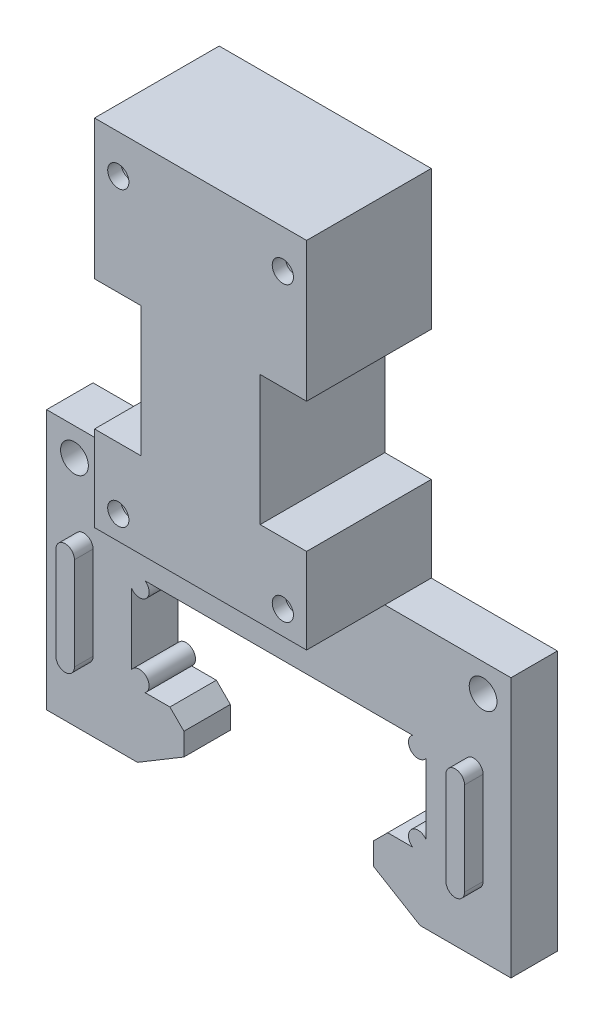
from build123d import *

# Parameters (mm, degrees)
ESQUISSE1_W             = 63.5
ESQUISSE1_H             = 35.56
BOSS_EXTRU_1_DEPTH      = 6.35
BOSS_EXTRU_2_DEPTH      = 2.54
EMPREINTE1_DEPTH        = 6.35
D_PLACER_LA_FACE2_DEPTH = 6.35
CHANFREIN1_SIZE         = 6.35
CHANFREIN1_SIZE2        = 3.81
CHANFREIN2_SIZE         = 6.35
CHANFREIN2_SIZE2        = 3.81
ESQUISSE3_W             = 29
ESQUISSE3_H             = 17.046330794
BOSS_EXTRU_3_DEPTH      = 48.514
ESQUISSE4_R             = 2.341041465
ENL_V_MAT_EXTRU_1_DEPTH = 15.24
ESQUISSE5_R             = 1.397
ESQUISSE5_W             = 6.35
ESQUISSE5_H             = 17.78
ENL_V_MAT_EXTRU_2_DEPTH = 78.134580407
D_GAGEMENT_M2_51_D      = 2.9
D_GAGEMENT_61_D         = 3.7973


# Read off the part's stored shape, not the designer's step: Empreinte1, Déplacer la face2
with BuildPart() as part:
    # Esquisse1 → Boss.-Extru.1 (new body)
    with BuildSketch(Plane.XY):
        with Locations((0, 1.905)):
            Rectangle(ESQUISSE1_W, ESQUISSE1_H)
    extrude(amount=BOSS_EXTRU_1_DEPTH)

    # Esquisse2 → Boss.-Extru.2 (add)
    with BuildSketch(Plane.XY.offset(6.35)):
        with BuildLine():
            Line((-27.94, -6.35), (-27.94, 6.35))
            ThreePointArc((-27.94, 6.35), (-26.67, 7.62), (-25.4, 6.35))
            Line((-25.4, 6.35), (-25.4, -6.35))
            ThreePointArc((-25.4, -6.35), (-26.67, -7.62), (-27.94, -6.35))
        make_face()
    boss_extru_2 = extrude(amount=BOSS_EXTRU_2_DEPTH)

    # Symétrie1: Boss.-Extru.2 across plane
    add(boss_extru_2.mirror(Plane(origin=(0, 0, 0), x_dir=(0, 0, 1), z_dir=(1, 0, 0))))

    # Empreinte1 outline → Empreinte1 (cut)
    with BuildSketch(Plane.XY):
        with BuildLine():
            Line((-11.90625, -8.5725), (-11.90625, -15.875))
            Line((-11.90625, -15.875), (11.90625, -15.875))
            Line((11.90625, -15.875), (11.90625, -8.5725))
            Line((11.90625, -8.5725), (14.44625, -6.0325))
            Line((14.44625, -6.0325), (16.66875, -6.0325))
            ThreePointArc((16.66875, -6.0325), (17.366201977, -4.348701977), (19.05, -3.65125))
            Line((19.05, -3.65125), (19.05, 2.69875))
            ThreePointArc((19.05, 2.69875), (17.366201977, 3.396201977), (16.66875, 5.08))
            Line((16.66875, 5.08), (-16.66875, 5.08))
            ThreePointArc((-16.66875, 5.08), (-17.366201977, 3.396201977), (-19.05, 2.69875))
            Line((-19.05, 2.69875), (-19.05, -3.65125))
            ThreePointArc((-19.05, -3.65125), (-17.366201977, -4.348701977), (-16.66875, -6.0325))
            Line((-16.66875, -6.0325), (-14.44625, -6.0325))
            Line((-14.44625, -6.0325), (-11.90625, -8.5725))
        make_face()
    extrude(amount=EMPREINTE1_DEPTH, mode=Mode.SUBTRACT)

    # Déplacer la face2 outline → Déplacer la face2 (cut)
    with BuildSketch(Plane.XY):
        with BuildLine():
            Line((-12.97305, -9.014383028), (-12.97305, -15.875))
            Line((-12.97305, -15.875), (-11.90625, -15.875))
            Line((-11.90625, -15.875), (-11.90625, -8.5725))
            Line((-11.90625, -8.5725), (-14.44625, -6.0325))
            Line((-14.44625, -6.0325), (-16.66875, -6.0325))
            ThreePointArc((-16.66875, -6.0325), (-17.366201977, -4.348701977), (-19.05, -3.65125))
            Line((-19.05, -3.65125), (-19.05, 2.69875))
            ThreePointArc((-19.05, 2.69875), (-17.366201977, 3.396201977), (-16.66875, 5.08))
            Line((-16.66875, 5.08), (16.66875, 5.08))
            ThreePointArc((16.66875, 5.08), (17.366201977, 3.396201977), (19.05, 2.69875))
            Line((19.05, 2.69875), (19.05, -3.65125))
            ThreePointArc((19.05, -3.65125), (17.366201977, -4.348701977), (16.66875, -6.0325))
            Line((16.66875, -6.0325), (14.44625, -6.0325))
            Line((14.44625, -6.0325), (11.90625, -8.5725))
            Line((11.90625, -8.5725), (11.90625, -15.875))
            Line((11.90625, -15.875), (12.97305, -15.875))
            Line((12.97305, -15.875), (12.97305, -9.014383028))
            Line((12.97305, -9.014383028), (14.888133028, -7.0993))
            Line((14.888133028, -7.0993), (18.282069949, -7.0993))
            ThreePointArc((18.282069949, -7.0993), (18.120543491, -5.103043491), (20.1168, -5.264569949))
            Line((20.1168, -5.264569949), (20.1168, 4.312069949))
            ThreePointArc((20.1168, 4.312069949), (18.120543491, 4.150543491), (18.282069949, 6.1468))
            Line((18.282069949, 6.1468), (-18.282069949, 6.1468))
            ThreePointArc((-18.282069949, 6.1468), (-18.120543491, 4.150543491), (-20.1168, 4.312069949))
            Line((-20.1168, 4.312069949), (-20.1168, -5.264569949))
            ThreePointArc((-20.1168, -5.264569949), (-18.120543491, -5.103043491), (-18.282069949, -7.0993))
            Line((-18.282069949, -7.0993), (-14.888133028, -7.0993))
            Line((-14.888133028, -7.0993), (-12.97305, -9.014383028))
        make_face()
    extrude(amount=D_PLACER_LA_FACE2_DEPTH, mode=Mode.SUBTRACT)

    # Chanfrein1
    chanfrein1_edges = [part.edges().sort_by_distance(p)[0] for p in [
        (12.97305, -15.875, 3.175),
    ]]
    chanfrein1_side = [part.faces().sort_by_distance(p)[0] for p in [
        (22.361525, -15.875, 3.175),
    ]]
    chamfer(chanfrein1_edges, length=CHANFREIN1_SIZE, length2=CHANFREIN1_SIZE2, reference=chanfrein1_side[0])

    # Chanfrein2
    chanfrein2_edges = [part.edges().sort_by_distance(p)[0] for p in [
        (-12.97305, -15.875, 3.175),
    ]]
    chanfrein2_side = [part.faces().sort_by_distance(p)[0] for p in [
        (-22.361525, -15.875, 3.175),
    ]]
    chamfer(chanfrein2_edges, length=CHANFREIN2_SIZE, length2=CHANFREIN2_SIZE2, reference=chanfrein2_side[0])

    # Esquisse3 → Boss.-Extru.3 (add)
    with BuildSketch(Plane(origin=(0, 19.685, 0), x_dir=(1, 0, 0), z_dir=(0, 1, 0))):
        with Locations((0, -8.523165397)):
            Rectangle(ESQUISSE3_W, ESQUISSE3_H)
    extrude(amount=BOSS_EXTRU_3_DEPTH)

    # Esquisse4 → Enlèv. mat.-Extru.1 (cut)
    with BuildSketch(Plane(origin=(0, 0, 0), x_dir=(-1, 0, 0), z_dir=(0, 0, -1))):
        with Locations((-11.25, 62.935)):
            Circle(ESQUISSE4_R)
        with Locations((11.25, 62.935)):
            Circle(ESQUISSE4_R)
        with Locations((11.25, 22.935)):
            Circle(ESQUISSE4_R)
        with Locations((-11.25, 22.935)):
            Circle(ESQUISSE4_R)
    extrude(amount=-ENL_V_MAT_EXTRU_1_DEPTH, mode=Mode.SUBTRACT)

    # Esquisse5 → Enlèv. mat.-Extru.2 (cut, through all)
    with BuildSketch(Plane(origin=(0, 0, 0), x_dir=(-1, 0, 0), z_dir=(0, 0, -1))):
        with Locations((-11.25, 22.935)):
            Circle(ESQUISSE5_R)
        with Locations((-11.25, 62.935)):
            Circle(ESQUISSE5_R)
        with Locations((11.25, 62.935)):
            Circle(ESQUISSE5_R)
        with Locations((11.25, 22.935)):
            Circle(ESQUISSE5_R)
        with Locations((11.325, 40.259)):
            Rectangle(ESQUISSE5_W, ESQUISSE5_H)
        with Locations((-11.325, 40.259)):
            Rectangle(ESQUISSE5_W, ESQUISSE5_H)
    extrude(amount=-ENL_V_MAT_EXTRU_2_DEPTH, mode=Mode.SUBTRACT)

    # Dégagement M2.51 (through all)
    with Locations(Plane(origin=(0, 0, 0), x_dir=(-1, 0, 0), z_dir=(0, 0, -1))):
        with Locations((11.25, 62.935), (-11.25, 62.935), (11.25, 22.935), (-11.25, 22.935)):
            Hole(D_GAGEMENT_M2_51_D / 2)

    # Dégagement #61 (through all)
    with Locations(Plane(origin=(0, 0, 0), x_dir=(-1, 0, 0), z_dir=(0, 0, -1))):
        with Locations((-27.94, 15.875), (27.94, 15.875)):
            Hole(D_GAGEMENT_61_D / 2)


solid = part.part
